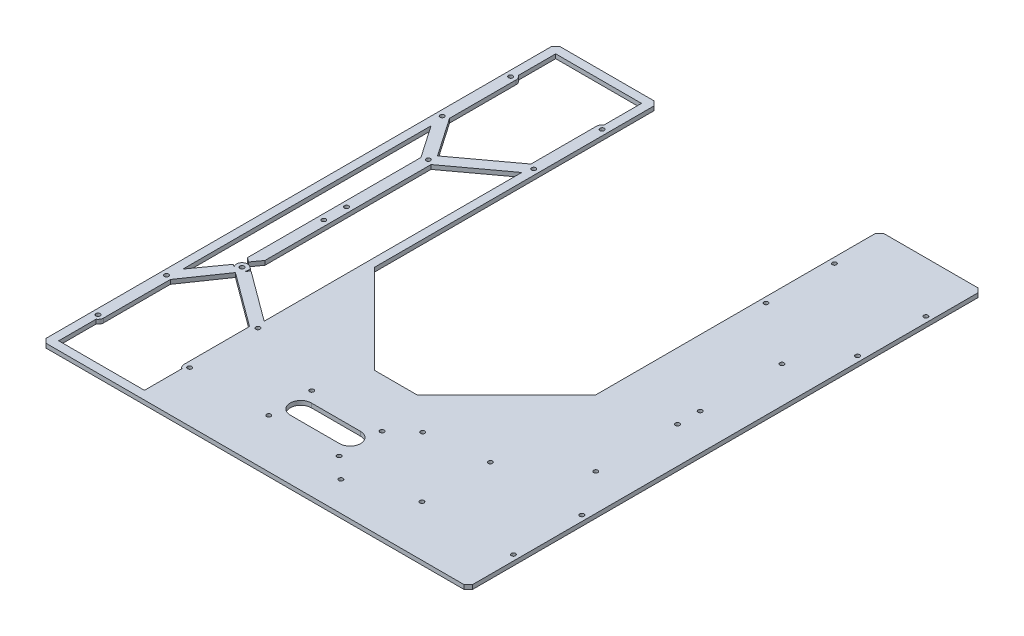
from build123d import *

# Parameters (mm, degrees)
SKETCH1_R           = 1.5
BOSS_EXTRUDE1_DEPTH = 3
CHAMFER1_SIZE       = 3


with BuildPart() as part:
    # Sketch1 → Boss-Extrude1 (new body)
    with BuildSketch(Plane(origin=(0, 0, 0), x_dir=(1, 0, 0), z_dir=(0, 1, 0))):
        Polygon((0, 0), (0, -365), (302.93, -365), (302.93, 0), (230, 0), (230, -201.465), (166.465, -265), (136.465, -265), (72.93, -201.465), (72.93, 0), align=None)
        with Locations(Location((3.97, -328.99, 0), (0, 0, 270))):
            Circle(SKETCH1_R, mode=Mode.SUBTRACT)
        with Locations(Location((68.96, -328.99, 0), (0, 0, 270))):
            Circle(SKETCH1_R, mode=Mode.SUBTRACT)
        with BuildLine():
            Line((26.803641974, -254.267576658), (64.99, -282.415618293))
            Line((64.99, -282.415618293), (64.99, -328.99))
            ThreePointArc((64.99, -328.99), (65.508913215, -330.952371015), (66.93, -332.401744422))
            Line((66.93, -332.401744422), (66.93, -359))
            Line((66.93, -359), (6, -359))
            Line((6, -359), (6, -332.401744422))
            ThreePointArc((6, -332.401744422), (7.421086785, -330.952371015), (7.94, -328.99))
            Line((7.94, -328.99), (7.94, -281.645279056))
            Line((7.94, -281.645279056), (26.803641974, -254.267576658))
        make_face(mode=Mode.SUBTRACT)
        with Locations(Location((3.97, -280.41, 0), (0, 0, 270))):
            Circle(SKETCH1_R, mode=Mode.SUBTRACT)
        with Locations(Location((126.465, -330.25, 0), (0, 0, 270))):
            Circle(SKETCH1_R, mode=Mode.SUBTRACT)
        with BuildLine():
            ThreePointArc((133.965, -322.5), (126.465, -315), (133.965, -307.5))
            Line((133.965, -307.5), (168.965, -307.5))
            ThreePointArc((168.965, -307.5), (176.465, -315), (168.965, -322.5))
            Line((168.965, -322.5), (133.965, -322.5))
        make_face(mode=Mode.SUBTRACT)
        with Locations(Location((126.465, -299.75, 0), (0, 0, 270))):
            Circle(SKETCH1_R, mode=Mode.SUBTRACT)
        with Locations(Location((25.86, -248.64, 0), (0, 0, 270))):
            Circle(SKETCH1_R, mode=Mode.SUBTRACT)
        with Locations(Location((25.86, -190.57, 0), (0, 0, 270))):
            Circle(SKETCH1_R, mode=Mode.SUBTRACT)
        with Locations(Location((176.465, -330.25, 0), (0, 0, 270))):
            Circle(SKETCH1_R, mode=Mode.SUBTRACT)
        with Locations(Location((191.465, -344.035, 0), (0, 0, 270))):
            Circle(SKETCH1_R, mode=Mode.SUBTRACT)
        with Locations(Location((176.465, -299.75, 0), (0, 0, 270))):
            Circle(SKETCH1_R, mode=Mode.SUBTRACT)
        with Locations(Location((191.465, -285.965, 0), (0, 0, 270))):
            Circle(SKETCH1_R, mode=Mode.SUBTRACT)
        with Locations(Location((233.97, -328.99, 0), (0, 0, 270))):
            Circle(SKETCH1_R, mode=Mode.SUBTRACT)
        with Locations(Location((298.96, -328.99, 0), (0, 0, 270))):
            Circle(SKETCH1_R, mode=Mode.SUBTRACT)
        with Locations(Location((233.97, -280.41, 0), (0, 0, 270))):
            Circle(SKETCH1_R, mode=Mode.SUBTRACT)
        with Locations(Location((298.96, -280.41, 0), (0, 0, 270))):
            Circle(SKETCH1_R, mode=Mode.SUBTRACT)
        with Locations(Location((277.07, -248.64, 0), (0, 0, 270))):
            Circle(SKETCH1_R, mode=Mode.SUBTRACT)
        with Locations(Location((277.07, -190.57, 0), (0, 0, 270))):
            Circle(SKETCH1_R, mode=Mode.SUBTRACT)
        with Locations(Location((25.86, -174.43, 0), (0, 0, 270))):
            Circle(SKETCH1_R, mode=Mode.SUBTRACT)
        with BuildLine():
            Line((66.93, -91.018356112), (66.93, -273.981643888))
            Line((66.93, -273.981643888), (31.310895985, -247.725984153))
            Line((31.310895985, -247.725984153), (29.129132873, -250.892480912))
            ThreePointArc((29.129132873, -250.892480912), (29.650735912, -249.819500423), (29.83, -248.64))
            Line((29.83, -248.64), (29.83, -246.634381707))
            Line((29.83, -246.634381707), (28.215581853, -245.444357008))
            ThreePointArc((28.215581853, -245.444357008), (22.664357008, -246.284418147), (23.504418147, -251.835642992))
            Line((23.504418147, -251.835642992), (20.948445099, -249.951576548))
            Line((20.948445099, -249.951576548), (6, -270.774610859))
            Line((6, -270.774610859), (6, -94.53336494))
            Line((6, -94.53336494), (21.89, -117.595279056))
            Line((21.89, -117.595279056), (21.89, -240.781625326))
            Line((21.89, -240.781625326), (24.979472521, -243.058946487))
            Line((24.979472521, -243.058946487), (29.83, -236.302210288))
            Line((29.83, -236.302210288), (29.83, -118.365618293))
            Line((29.83, -118.365618293), (66.93, -91.018356112))
        make_face(mode=Mode.SUBTRACT)
        with Locations(Location((25.86, -116.36, 0), (0, 0, 270))):
            Circle(SKETCH1_R, mode=Mode.SUBTRACT)
        with Locations(Location((3.97, -84.59, 0), (0, 0, 270))):
            Circle(SKETCH1_R, mode=Mode.SUBTRACT)
        with BuildLine():
            Line((64.99, -82.584381707), (26.803641974, -110.732423342))
            Line((26.803641974, -110.732423342), (7.94, -83.354720944))
            Line((7.94, -83.354720944), (7.94, -36.01))
            ThreePointArc((7.94, -36.01), (7.421086785, -34.047628985), (6, -32.598255578))
            Line((6, -32.598255578), (6, -6))
            Line((6, -6), (66.93, -6))
            Line((66.93, -6), (66.93, -32.598255578))
            ThreePointArc((66.93, -32.598255578), (65.508913215, -34.047628985), (64.99, -36.01))
            Line((64.99, -36.01), (64.99, -82.584381707))
        make_face(mode=Mode.SUBTRACT)
        with Locations(Location((68.96, -84.59, 0), (0, 0, 270))):
            Circle(SKETCH1_R, mode=Mode.SUBTRACT)
        with Locations(Location((3.97, -36.01, 0), (0, 0, 270))):
            Circle(SKETCH1_R, mode=Mode.SUBTRACT)
        with Locations(Location((68.96, -36.01, 0), (0, 0, 270))):
            Circle(SKETCH1_R, mode=Mode.SUBTRACT)
        with Locations(Location((277.07, -174.43, 0), (0, 0, 270))):
            Circle(SKETCH1_R, mode=Mode.SUBTRACT)
        with Locations(Location((277.07, -116.36, 0), (0, 0, 270))):
            Circle(SKETCH1_R, mode=Mode.SUBTRACT)
        with Locations(Location((233.97, -84.59, 0), (0, 0, 270))):
            Circle(SKETCH1_R, mode=Mode.SUBTRACT)
        with Locations(Location((298.96, -84.59, 0), (0, 0, 270))):
            Circle(SKETCH1_R, mode=Mode.SUBTRACT)
        with Locations(Location((233.97, -36.01, 0), (0, 0, 270))):
            Circle(SKETCH1_R, mode=Mode.SUBTRACT)
        with Locations(Location((298.96, -36.01, 0), (0, 0, 270))):
            Circle(SKETCH1_R, mode=Mode.SUBTRACT)
        with Locations(Location((68.96, -280.41, 0), (0, 0, 270))):
            Circle(SKETCH1_R, mode=Mode.SUBTRACT)
    extrude(amount=BOSS_EXTRUDE1_DEPTH)

    # Chamfer1
    chamfer1_edges = [part.edges().sort_by_distance(p)[0] for p in [
        (72.93, 1.5, 0),
        (230, 1.5, 0),
        (302.93, 1.5, 0),
        (302.93, 1.5, 365),
        (0, 1.5, 365),
        (0, 1.5, 0),
    ]]
    chamfer(chamfer1_edges, length=CHAMFER1_SIZE)


solid = part.part
